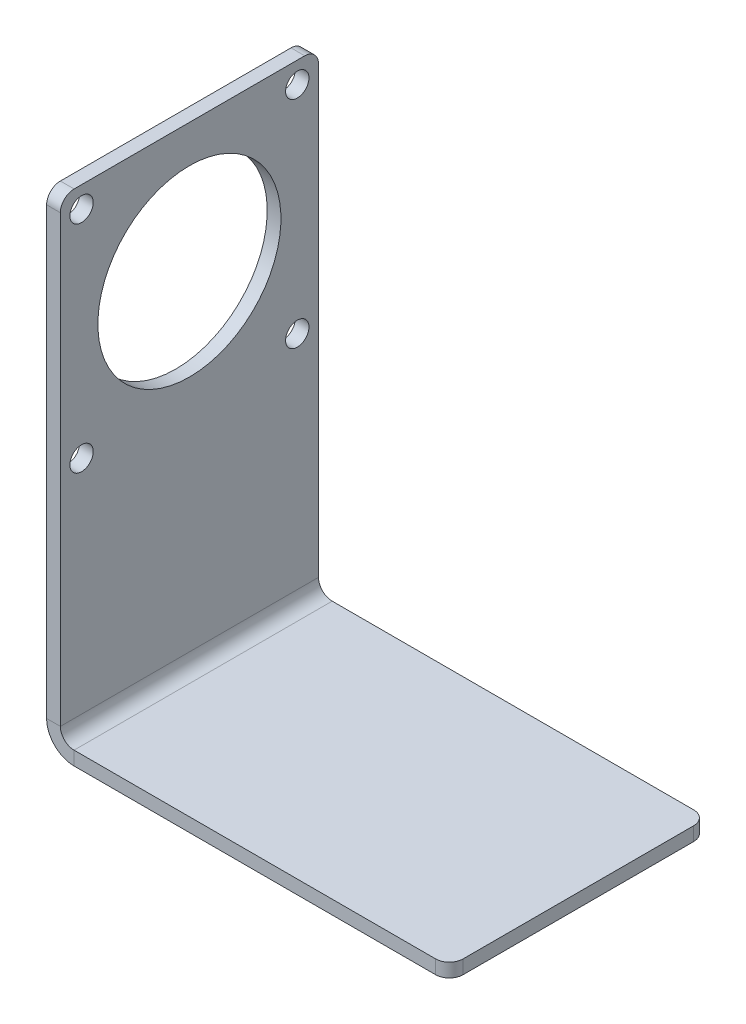
from build123d import *

# Parameters (mm, degrees)
SM_BASE_FLANGE_1_DEPTH = 56.4
FILLET_1_R             = 3
SKETCH_6_R             = 20
SKETCH_6_R_2           = 2.55
CUT_EXTRUDE_1_DEPTH    = 148.256239257


# Sheet-metal steps are written as plain solids
with BuildPart() as part:
    # Sketch 1 → Базовая кромка1 (new body)
    with BuildSketch(Plane.XY):
        with BuildLine():
            Line((0, 0), (0, -100.2))
            ThreePointArc((0, -100.2), (0.878679656, -102.321320344), (3, -103.2))
            Line((3, -103.2), (85, -103.2))
            Line((85, -103.2), (85, -106.2))
            Line((85, -106.2), (3, -106.2))
            ThreePointArc((3, -106.2), (-1.242640687, -104.442640687), (-3, -100.2))
            Line((-3, -100.2), (-3, 0))
            Line((-3, 0), (0, 0))
        make_face()
    extrude(amount=SM_BASE_FLANGE_1_DEPTH)

    # Скругление1
    fillet_1_edges = [part.edges().sort_by_distance(p)[0] for p in [
        (-1.5, 0, 56.4),
        (85, -104.7, 56.4),
        (-1.5, 0, 0),
        (85, -104.7, 0),
    ]]
    fillet(fillet_1_edges, radius=FILLET_1_R)

    # Эскиз6 → Вырез-Вытянуть1 (cut, through all)
    with BuildSketch(Plane(origin=(0, 0, 0), x_dir=(0, 0, -1), z_dir=(1, 0, 0))):
        with Locations(Location((-28.2, -28.2, 0), (0, 0, 90))):
            Circle(SKETCH_6_R)
        with Locations(Location((-51.77, -4.63, 0), (0, 0, 90))):
            Circle(SKETCH_6_R_2)
        with Locations(Location((-4.63, -4.63, 0), (0, 0, 90))):
            Circle(SKETCH_6_R_2)
        with Locations(Location((-4.63, -51.77, 0), (0, 0, 90))):
            Circle(SKETCH_6_R_2)
        with Locations(Location((-51.77, -51.77, 0), (0, 0, 90))):
            Circle(SKETCH_6_R_2)
    extrude(amount=-CUT_EXTRUDE_1_DEPTH, mode=Mode.SUBTRACT)


solid = part.part
